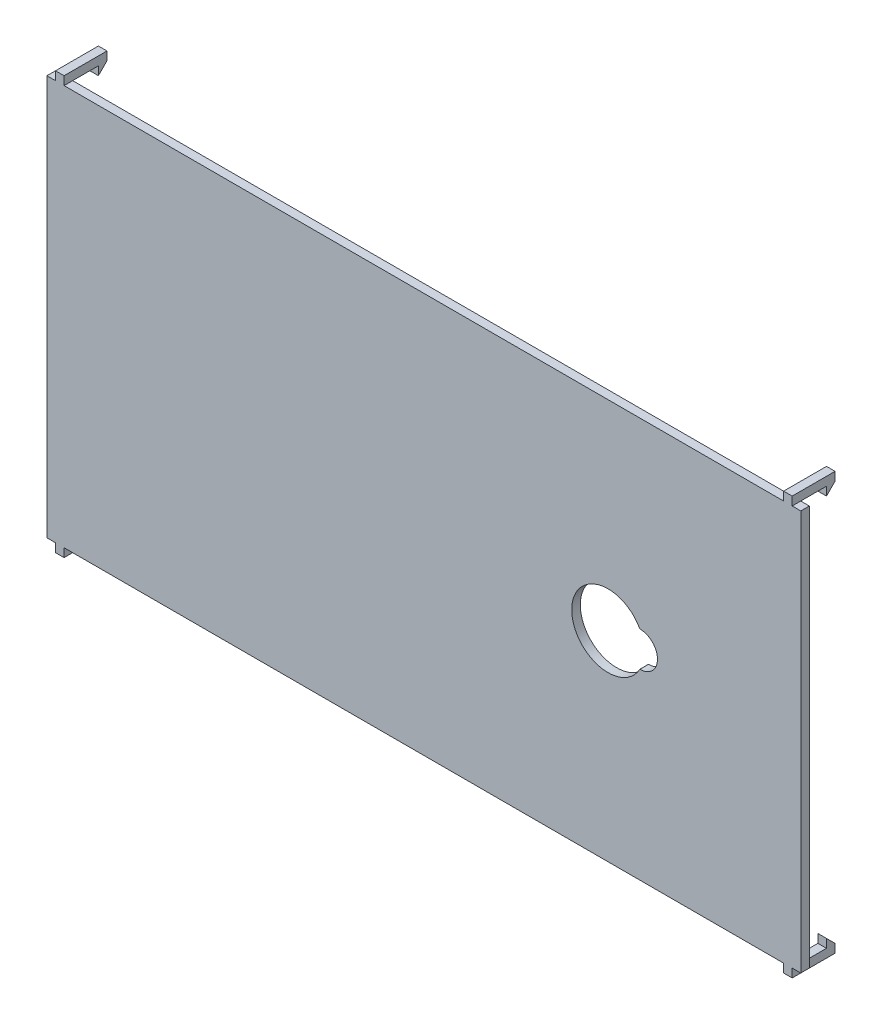
from build123d import *

# Parameters (mm, degrees)
SKETCH1_W            = 131.85
SKETCH1_H            = 70
BOSS_EXTRUDE1_DEPTH  = 1.5
CUT_EXTRUDE1_REACH   = 137.268
BOSS_EXTRUDE2_START  = -1.5
BOSS_EXTRUDE2_DEPTH  = 1.5
MIRROR2_START        = -1.5
MIRROR2_COPY_1_DEPTH = 1.5


with BuildPart() as part:
    # Sketch1 → Boss-Extrude1 (new body)
    with BuildSketch(Plane.XY):
        with Locations((55.175, 25.25)):
            Rectangle(SKETCH1_W, SKETCH1_H)
    extrude(amount=BOSS_EXTRUDE1_DEPTH)

    # Sketch2 → Cut-Extrude1 (cut, up to next)
    with BuildSketch(Plane.XY.offset(1.5), mode=Mode.PRIVATE) as cut_extrude1_sk1:
        with BuildLine():
            Line((92.957060126, 22.2), (92.9875, 22.2))
            ThreePointArc((92.9875, 22.2), (96.0375, 25.25), (92.9875, 28.3))
            Line((92.9875, 28.3), (92.957060126, 28.3))
            ThreePointArc((92.957060126, 28.3), (81.0375, 25.25), (92.957060126, 22.2))
        make_face()
    cut_extrude1_tool1 = extrude(cut_extrude1_sk1.sketch, amount=-CUT_EXTRUDE1_REACH, mode=Mode.PRIVATE) & part.part
    add(cut_extrude1_tool1.solids().sort_by_distance((87.98685, 25.25, 1.5))[0], mode=Mode.SUBTRACT)

    # Sketch3 → Boss-Extrude2 (add)
    with BuildSketch(Plane(origin=(121.1, 0, 0), x_dir=(0, 0, -1), z_dir=(1, 0, 0)).offset(BOSS_EXTRUDE2_START)):
        Polygon((-1.5, 61.75), (-1.5, 60.25), (4.5, 60.25), (4.5, 58.75), (6, 60.25), (6, 61.75), align=None)
    boss_extrude2 = extrude(amount=-BOSS_EXTRUDE2_DEPTH)

    # Mirror1: Boss-Extrude2 across plane
    add(boss_extrude2.mirror(Plane(origin=(55.175, 0, 0), x_dir=(0, 0, 1), z_dir=(1, 0, 0))))

    # Mirror2: Boss-Extrude2 across plane
    add(boss_extrude2.mirror(Plane.ZX.offset(25.25)))

    # Mirror2 copy 1 sketch → Mirror2 copy 1 (add)
    with BuildSketch(Plane(origin=(-10.75, 50.5, 0), x_dir=(0, 0, -1), z_dir=(-1, 0, 0)).offset(MIRROR2_START)):
        Polygon((-1.5, 61.75), (-1.5, 60.25), (4.5, 60.25), (4.5, 58.75), (6, 60.25), (6, 61.75), align=None)
    extrude(amount=-MIRROR2_COPY_1_DEPTH)


solid = part.part
